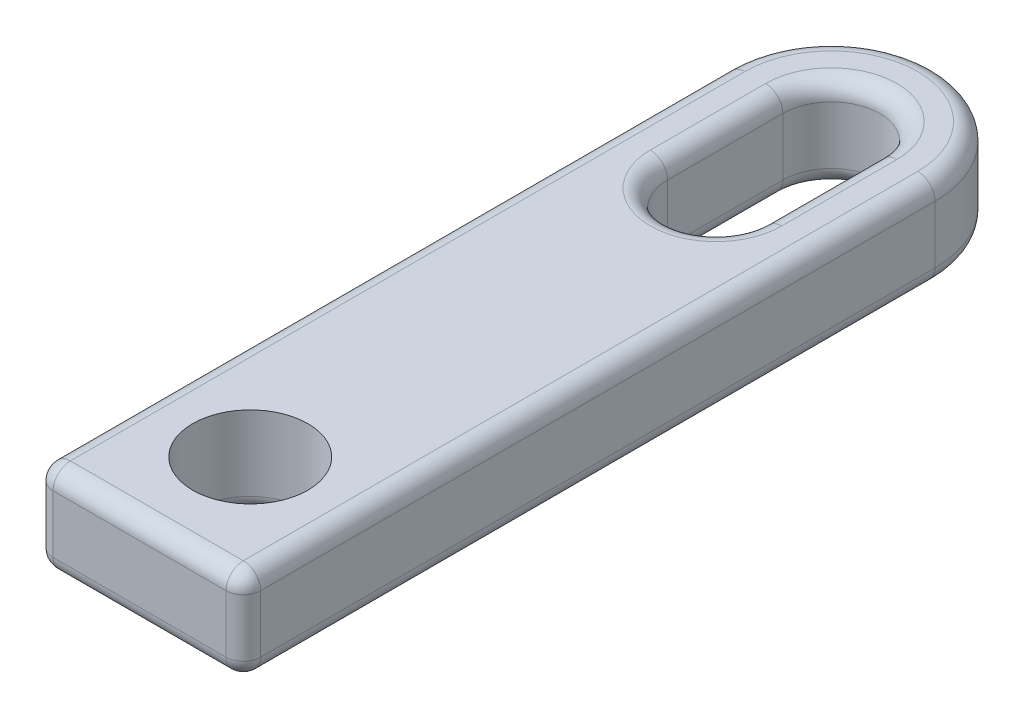
from build123d import *

# Parameters (mm, degrees)
SKETCH1_R           = 2.5
BOSS_EXTRUDE1_DEPTH = 4
FILLET1_R           = 0.75


with BuildPart() as part:
    # Sketch1 → Boss-Extrude1 (new body)
    with BuildSketch(Plane(origin=(0, 0, 0), x_dir=(1, 0, 0), z_dir=(0, 1, 0))):
        with BuildLine():
            Line((-4.5, -17.44915748), (-4.5, -7.44915748))
            ThreePointArc((-4.5, -7.44915748), (0, -2.94915748), (4.5, -7.44915748))
            Line((4.5, -7.44915748), (4.5, -27.44915748))
            Line((4.5, -27.44915748), (4.5, -37.44915748))
            Line((4.5, -37.44915748), (-4.5, -37.44915748))
            Line((-4.5, -37.44915748), (-4.5, -17.44915748))
        make_face()
        with Locations((0, -32.64915748)):
            Circle(SKETCH1_R, mode=Mode.SUBTRACT)
        with BuildLine():
            Line((2.1, -7.44915748), (2.1, -12.44915748))
            ThreePointArc((2.1, -12.44915748), (0, -14.54915748), (-2.1, -12.44915748))
            Line((-2.1, -12.44915748), (-2.1, -7.44915748))
            ThreePointArc((-2.1, -7.44915748), (0, -5.34915748), (2.1, -7.44915748))
        make_face(mode=Mode.SUBTRACT)
    extrude(amount=BOSS_EXTRUDE1_DEPTH)

    # Fillet1
    fillet1_edges = [part.edges().sort_by_distance(p)[0] for p in [
        (-4.5, 4, 22.44915748),
        (-4.5, 2, 37.44915748),
        (0, 4, 37.44915748),
        (2.1, 0, 9.94915748),
        (0, 0, 14.54915748),
        (-2.1, 0, 9.94915748),
        (0, 0, 5.34915748),
        (-4.5, 0, 22.44915748),
        (0, 0, 37.44915748),
        (0, 4, 2.94915748),
        (0, 0, 2.94915748),
        (4.5, 2, 37.44915748),
        (4.5, 4, 22.44915748),
        (4.5, 0, 22.44915748),
        (0, 4, 5.34915748),
        (2.1, 4, 9.94915748),
        (0, 4, 14.54915748),
        (-2.1, 4, 9.94915748),
        (-2.5, 0, 32.64915748),
    ]]
    fillet(fillet1_edges, radius=FILLET1_R)


solid = part.part
